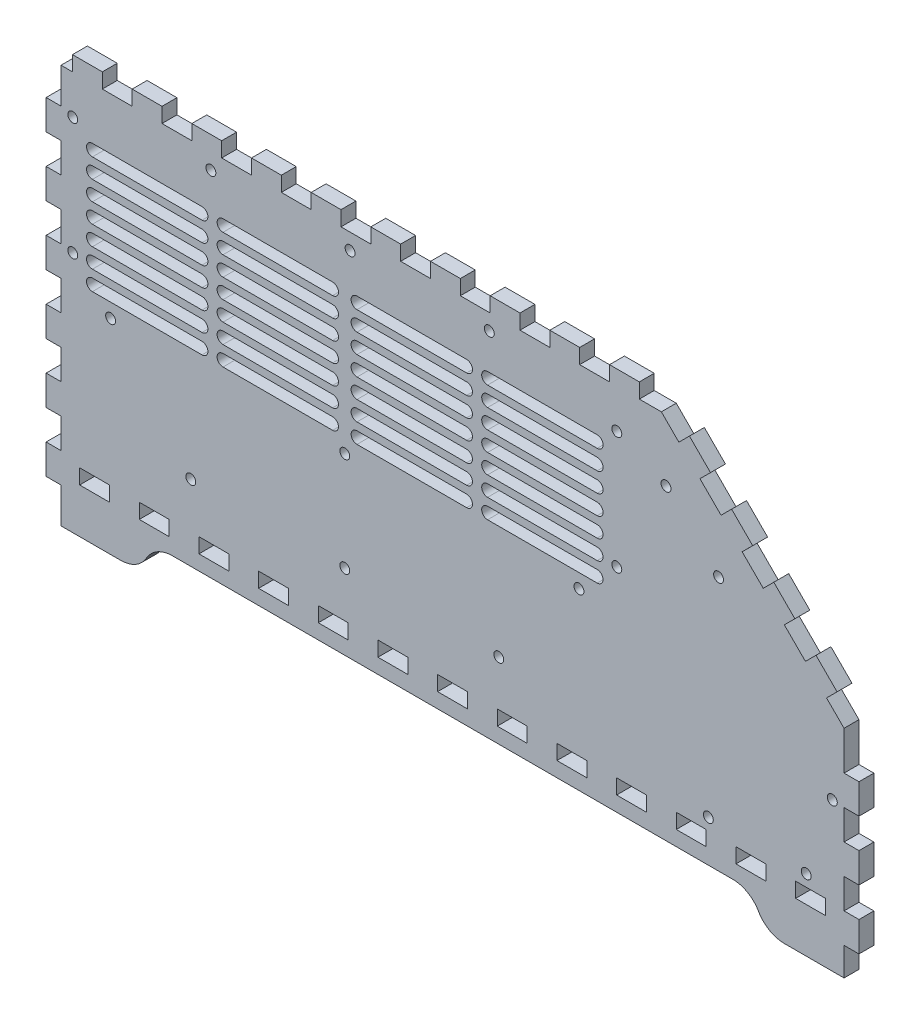
from build123d import *

# Parameters (mm, degrees)
BOSS_EXTRUDE1_DEPTH   = 5.715
CUT_EXTRUDE1_DEPTH    = 370.493090076
F_6_CLEARANCE_HOLE1_D = 3.7973


with BuildPart() as part:
    # Model → Boss-Extrude1 (new body)
    with BuildSketch(Plane.XY):
        Polygon((16.1148, 22.8575), (38.9749, 22.8575), (39.3485, 22.8575), (40.4689, 22.9567), (41.9322, 23.2475), (43.3447, 23.7271), (44.366, 24.2025), (44.6899, 24.3885), (44.8511, 24.4822), (45.3263, 24.7854), (45.9341, 25.2222), (46.5116, 25.6963), (47.056, 26.2062), (47.5657, 26.7505), (48.0399, 27.3279), (48.4766, 27.9356), (48.7796, 28.411), (48.8735, 28.5722), (48.9673, 28.7348), (49.2689, 29.2103), (49.7057, 29.818), (50.1798, 30.3954), (50.6899, 30.9397), (51.2339, 31.4496), (51.8114, 31.9236), (52.4192, 32.3605), (52.8948, 32.6622), (53.0571, 32.756), (53.3799, 32.9434), (54.4008, 33.4188), (55.8133, 33.8983), (57.2766, 34.1891), (58.3971, 34.287), (58.7721, 34.287), (273.458, 34.287), (273.831, 34.287), (274.952, 34.1891), (276.415, 33.8983), (277.828, 33.4188), (278.849, 32.9434), (279.172, 32.756), (279.334, 32.6636), (279.809, 32.3605), (280.417, 31.9236), (280.995, 31.4496), (281.539, 30.9397), (282.049, 30.3954), (282.523, 29.818), (282.96, 29.2103), (283.263, 28.7348), (283.356, 28.5722), (283.449, 28.411), (283.752, 27.9356), (284.189, 27.3279), (284.663, 26.7505), (285.172, 26.2062), (285.717, 25.6963), (286.294, 25.2222), (286.902, 24.7854), (287.377, 24.4822), (287.54, 24.3885), (287.862, 24.2025), (288.884, 23.7271), (290.296, 23.2475), (291.76, 22.9567), (292.88, 22.8575), (293.255, 22.8575), (316.115, 22.8575), (316.115, 33.6917), (321.83, 33.6917), (321.83, 45.1224), (316.115, 45.1224), (316.115, 56.552), (321.83, 56.552), (321.83, 67.9813), (316.115, 67.9813), (316.115, 79.412), (321.83, 79.412), (321.83, 90.8417), (316.115, 90.8417), (316.115, 101.677), (316.115, 105.718), (309.403, 112.43), (313.444, 116.47), (305.362, 124.553), (301.321, 120.512), (293.238, 128.595), (297.28, 132.635), (289.198, 140.717), (285.156, 136.677), (277.074, 144.759), (281.114, 148.801), (273.032, 156.881), (268.992, 152.841), (260.91, 160.923), (264.951, 164.963), (256.869, 173.046), (252.827, 169.005), (246.115, 175.718), (242.074, 175.718), (237.68, 175.718), (237.68, 181.433), (226.249, 181.433), (226.249, 175.718), (214.82, 175.718), (214.82, 181.433), (203.389, 181.433), (203.389, 175.718), (191.959, 175.718), (191.959, 181.433), (180.53, 181.433), (180.53, 175.718), (169.099, 175.718), (169.099, 181.433), (157.67, 181.433), (157.67, 175.718), (146.239, 175.718), (146.239, 181.433), (134.809, 181.433), (134.809, 175.718), (123.38, 175.718), (123.38, 181.433), (111.949, 181.433), (111.949, 175.718), (100.52, 175.718), (100.52, 181.433), (89.0887, 181.433), (89.0887, 175.718), (77.6594, 175.718), (77.6594, 181.433), (66.2298, 181.433), (66.2298, 175.718), (54.7991, 175.718), (54.7991, 181.433), (43.3698, 181.433), (43.3698, 175.718), (31.9388, 175.718), (31.9388, 181.433), (20.5093, 181.433), (20.5093, 175.718), (16.1148, 175.718), (16.1148, 162.153), (10.4001, 162.153), (10.4001, 150.723), (16.1148, 150.723), (16.1148, 139.292), (10.4001, 139.292), (10.4001, 127.863), (16.1148, 127.863), (16.1148, 116.433), (10.4001, 116.433), (10.4001, 105.003), (16.1148, 105.003), (16.1148, 93.5729), (10.4001, 93.5729), (10.4001, 82.1422), (16.1148, 82.1422), (16.1148, 70.7125), (10.4001, 70.7125), (10.4001, 59.2832), (16.1148, 59.2832), (16.1148, 47.8525), (10.4001, 47.8525), (10.4001, 36.4229), (16.1148, 36.4229), align=None)
        Polygon((28.9553, 40.0032), (23.2406, 40.0032), (23.2406, 45.7179), (34.67, 45.7179), (34.67, 40.0032), align=None, mode=Mode.SUBTRACT)
        Polygon((51.8156, 40.0032), (46.0996, 40.0032), (46.0996, 45.7179), (57.5303, 45.7179), (57.5303, 40.0032), align=None, mode=Mode.SUBTRACT)
        Polygon((74.6746, 40.0032), (68.9599, 40.0032), (68.9599, 45.7179), (80.3906, 45.7179), (80.3906, 40.0032), align=None, mode=Mode.SUBTRACT)
        Polygon((97.5349, 40.0032), (91.8199, 40.0032), (91.8199, 45.7179), (103.25, 45.7179), (103.25, 40.0032), align=None, mode=Mode.SUBTRACT)
        Polygon((120.395, 40.0032), (114.68, 40.0032), (114.68, 45.7179), (126.11, 45.7179), (126.11, 40.0032), align=None, mode=Mode.SUBTRACT)
        Polygon((143.255, 40.0032), (137.541, 40.0032), (137.541, 45.7179), (148.97, 45.7179), (148.97, 40.0032), align=None, mode=Mode.SUBTRACT)
        Polygon((166.116, 40.0032), (160.4, 40.0032), (160.4, 45.7179), (171.83, 45.7179), (171.83, 40.0032), align=None, mode=Mode.SUBTRACT)
        Polygon((188.975, 40.0032), (183.26, 40.0032), (183.26, 45.7179), (194.691, 45.7179), (194.691, 40.0032), align=None, mode=Mode.SUBTRACT)
        Polygon((211.835, 40.0032), (206.12, 40.0032), (206.12, 45.7179), (217.55, 45.7179), (217.55, 40.0032), align=None, mode=Mode.SUBTRACT)
        Polygon((234.695, 40.0032), (228.98, 40.0032), (228.98, 45.7179), (240.41, 45.7179), (240.41, 40.0032), align=None, mode=Mode.SUBTRACT)
        Polygon((257.555, 40.0032), (251.841, 40.0032), (251.841, 45.7179), (263.27, 45.7179), (263.27, 40.0032), align=None, mode=Mode.SUBTRACT)
        Polygon((280.416, 40.0032), (274.7, 40.0032), (274.7, 45.7179), (286.13, 45.7179), (286.13, 40.0032), align=None, mode=Mode.SUBTRACT)
        Polygon((303.275, 40.0032), (297.56, 40.0032), (297.56, 45.7179), (308.991, 45.7179), (308.991, 40.0032), align=None, mode=Mode.SUBTRACT)
    extrude(amount=BOSS_EXTRUDE1_DEPTH)

    # Sketch1 → Cut-Extrude1 (cut, through all)
    with BuildSketch(Plane(origin=(0, 0, 0), x_dir=(-1, 0, 0), z_dir=(0, 0, -1))):
        with BuildLine():
            Line((-221.535820417, 155.8109373), (-179.535820417, 155.8109373))
            ThreePointArc((-179.535820417, 155.8109373), (-177.285820417, 153.5609373), (-179.535820417, 151.3109373))
            Line((-179.535820417, 151.3109373), (-221.535820417, 151.3109373))
            ThreePointArc((-221.535820417, 151.3109373), (-223.785820417, 153.5609373), (-221.535820417, 155.8109373))
        make_face()
        with BuildLine():
            Line((-221.535820417, 143.8609373), (-179.535820417, 143.8609373))
            ThreePointArc((-179.535820417, 143.8609373), (-177.285820417, 146.1109373), (-179.535820417, 148.3609373))
            Line((-179.535820417, 148.3609373), (-221.535820417, 148.3609373))
            ThreePointArc((-221.535820417, 148.3609373), (-223.785820417, 146.1109373), (-221.535820417, 143.8609373))
        make_face()
        with BuildLine():
            Line((-221.535820417, 136.4109373), (-179.535820417, 136.4109373))
            ThreePointArc((-179.535820417, 136.4109373), (-177.285820417, 138.6609373), (-179.535820417, 140.9109373))
            Line((-179.535820417, 140.9109373), (-221.535820417, 140.9109373))
            ThreePointArc((-221.535820417, 140.9109373), (-223.785820417, 138.6609373), (-221.535820417, 136.4109373))
        make_face()
        with BuildLine():
            Line((-221.535820417, 128.9609373), (-179.535820417, 128.9609373))
            ThreePointArc((-179.535820417, 128.9609373), (-177.285820417, 131.2109373), (-179.535820417, 133.4609373))
            Line((-179.535820417, 133.4609373), (-221.535820417, 133.4609373))
            ThreePointArc((-221.535820417, 133.4609373), (-223.785820417, 131.2109373), (-221.535820417, 128.9609373))
        make_face()
        with BuildLine():
            Line((-221.535820417, 121.5109373), (-179.535820417, 121.5109373))
            ThreePointArc((-179.535820417, 121.5109373), (-177.285820417, 123.7609373), (-179.535820417, 126.0109373))
            Line((-179.535820417, 126.0109373), (-221.535820417, 126.0109373))
            ThreePointArc((-221.535820417, 126.0109373), (-223.785820417, 123.7609373), (-221.535820417, 121.5109373))
        make_face()
        with BuildLine():
            Line((-221.535820417, 114.0609373), (-179.535820417, 114.0609373))
            ThreePointArc((-179.535820417, 114.0609373), (-177.285820417, 116.3109373), (-179.535820417, 118.5609373))
            Line((-179.535820417, 118.5609373), (-221.535820417, 118.5609373))
            ThreePointArc((-221.535820417, 118.5609373), (-223.785820417, 116.3109373), (-221.535820417, 114.0609373))
        make_face()
        with BuildLine():
            Line((-221.535820417, 106.6109373), (-179.535820417, 106.6109373))
            ThreePointArc((-179.535820417, 106.6109373), (-177.285820417, 108.8609373), (-179.535820417, 111.1109373))
            Line((-179.535820417, 111.1109373), (-221.535820417, 111.1109373))
            ThreePointArc((-221.535820417, 111.1109373), (-223.785820417, 108.8609373), (-221.535820417, 106.6109373))
        make_face()
        with BuildLine():
            Line((-129.503720992, 111.1109373), (-171.503720992, 111.1109373))
            ThreePointArc((-171.503720992, 111.1109373), (-173.753720992, 108.8609373), (-171.503720992, 106.6109373))
            Line((-171.503720992, 106.6109373), (-129.503720992, 106.6109373))
            ThreePointArc((-129.503720992, 106.6109373), (-127.253720992, 108.8609373), (-129.503720992, 111.1109373))
        make_face()
        with BuildLine():
            Line((-129.503720992, 118.5609373), (-171.503720992, 118.5609373))
            ThreePointArc((-171.503720992, 118.5609373), (-173.753720992, 116.3109373), (-171.503720992, 114.0609373))
            Line((-171.503720992, 114.0609373), (-129.503720992, 114.0609373))
            ThreePointArc((-129.503720992, 114.0609373), (-127.253720992, 116.3109373), (-129.503720992, 118.5609373))
        make_face()
        with BuildLine():
            Line((-129.503720992, 126.0109373), (-171.503720992, 126.0109373))
            ThreePointArc((-171.503720992, 126.0109373), (-173.753720992, 123.7609373), (-171.503720992, 121.5109373))
            Line((-171.503720992, 121.5109373), (-129.503720992, 121.5109373))
            ThreePointArc((-129.503720992, 121.5109373), (-127.253720992, 123.7609373), (-129.503720992, 126.0109373))
        make_face()
        with BuildLine():
            Line((-129.503720992, 133.4609373), (-171.503720992, 133.4609373))
            ThreePointArc((-171.503720992, 133.4609373), (-173.753720992, 131.2109373), (-171.503720992, 128.9609373))
            Line((-171.503720992, 128.9609373), (-129.503720992, 128.9609373))
            ThreePointArc((-129.503720992, 128.9609373), (-127.253720992, 131.2109373), (-129.503720992, 133.4609373))
        make_face()
        with BuildLine():
            Line((-129.503720992, 140.9109373), (-171.503720992, 140.9109373))
            ThreePointArc((-171.503720992, 140.9109373), (-173.753720992, 138.6609373), (-171.503720992, 136.4109373))
            Line((-171.503720992, 136.4109373), (-129.503720992, 136.4109373))
            ThreePointArc((-129.503720992, 136.4109373), (-127.253720992, 138.6609373), (-129.503720992, 140.9109373))
        make_face()
        with BuildLine():
            Line((-129.503720992, 148.3609373), (-171.503720992, 148.3609373))
            ThreePointArc((-171.503720992, 148.3609373), (-173.753720992, 146.1109373), (-171.503720992, 143.8609373))
            Line((-171.503720992, 143.8609373), (-129.503720992, 143.8609373))
            ThreePointArc((-129.503720992, 143.8609373), (-127.253720992, 146.1109373), (-129.503720992, 148.3609373))
        make_face()
        with BuildLine():
            Line((-129.503720992, 155.8109373), (-171.503720992, 155.8109373))
            ThreePointArc((-171.503720992, 155.8109373), (-173.753720992, 153.5609373), (-171.503720992, 151.3109373))
            Line((-171.503720992, 151.3109373), (-129.503720992, 151.3109373))
            ThreePointArc((-129.503720992, 151.3109373), (-127.253720992, 153.5609373), (-129.503720992, 155.8109373))
        make_face()
        with BuildLine():
            Line((-28.134624406, 155.8109373), (-70.134624406, 155.8109373))
            ThreePointArc((-70.134624406, 155.8109373), (-72.384624406, 153.5609373), (-70.134624406, 151.3109373))
            Line((-70.134624406, 151.3109373), (-28.134624406, 151.3109373))
            ThreePointArc((-28.134624406, 151.3109373), (-25.884624406, 153.5609373), (-28.134624406, 155.8109373))
        make_face()
        with BuildLine():
            Line((-28.134624406, 148.3609373), (-70.134624406, 148.3609373))
            ThreePointArc((-70.134624406, 148.3609373), (-72.384624406, 146.1109373), (-70.134624406, 143.8609373))
            Line((-70.134624406, 143.8609373), (-28.134624406, 143.8609373))
            ThreePointArc((-28.134624406, 143.8609373), (-25.884624406, 146.1109373), (-28.134624406, 148.3609373))
        make_face()
        with BuildLine():
            Line((-28.134624406, 140.9109373), (-70.134624406, 140.9109373))
            ThreePointArc((-70.134624406, 140.9109373), (-72.384624406, 138.6609373), (-70.134624406, 136.4109373))
            Line((-70.134624406, 136.4109373), (-28.134624406, 136.4109373))
            ThreePointArc((-28.134624406, 136.4109373), (-25.884624406, 138.6609373), (-28.134624406, 140.9109373))
        make_face()
        with BuildLine():
            Line((-28.134624406, 133.4609373), (-70.134624406, 133.4609373))
            ThreePointArc((-70.134624406, 133.4609373), (-72.384624406, 131.2109373), (-70.134624406, 128.9609373))
            Line((-70.134624406, 128.9609373), (-28.134624406, 128.9609373))
            ThreePointArc((-28.134624406, 128.9609373), (-25.884624406, 131.2109373), (-28.134624406, 133.4609373))
        make_face()
        with BuildLine():
            Line((-28.134624406, 126.0109373), (-70.134624406, 126.0109373))
            ThreePointArc((-70.134624406, 126.0109373), (-72.384624406, 123.7609373), (-70.134624406, 121.5109373))
            Line((-70.134624406, 121.5109373), (-28.134624406, 121.5109373))
            ThreePointArc((-28.134624406, 121.5109373), (-25.884624406, 123.7609373), (-28.134624406, 126.0109373))
        make_face()
        with BuildLine():
            Line((-28.134624406, 118.5609373), (-70.134624406, 118.5609373))
            ThreePointArc((-70.134624406, 118.5609373), (-72.384624406, 116.3109373), (-70.134624406, 114.0609373))
            Line((-70.134624406, 114.0609373), (-28.134624406, 114.0609373))
            ThreePointArc((-28.134624406, 114.0609373), (-25.884624406, 116.3109373), (-28.134624406, 118.5609373))
        make_face()
        with BuildLine():
            Line((-28.134624406, 111.1109373), (-70.134624406, 111.1109373))
            ThreePointArc((-70.134624406, 111.1109373), (-72.384624406, 108.8609373), (-70.134624406, 106.6109373))
            Line((-70.134624406, 106.6109373), (-28.134624406, 106.6109373))
            ThreePointArc((-28.134624406, 106.6109373), (-25.884624406, 108.8609373), (-28.134624406, 111.1109373))
        make_face()
        with BuildLine():
            Line((-120.166723831, 111.1109373), (-78.166723831, 111.1109373))
            ThreePointArc((-78.166723831, 111.1109373), (-75.916723831, 108.8609373), (-78.166723831, 106.6109373))
            Line((-78.166723831, 106.6109373), (-120.166723831, 106.6109373))
            ThreePointArc((-120.166723831, 106.6109373), (-122.416723831, 108.8609373), (-120.166723831, 111.1109373))
        make_face()
        with BuildLine():
            Line((-120.166723831, 118.5609373), (-78.166723831, 118.5609373))
            ThreePointArc((-78.166723831, 118.5609373), (-75.916723831, 116.3109373), (-78.166723831, 114.0609373))
            Line((-78.166723831, 114.0609373), (-120.166723831, 114.0609373))
            ThreePointArc((-120.166723831, 114.0609373), (-122.416723831, 116.3109373), (-120.166723831, 118.5609373))
        make_face()
        with BuildLine():
            Line((-120.166723831, 126.0109373), (-78.166723831, 126.0109373))
            ThreePointArc((-78.166723831, 126.0109373), (-75.916723831, 123.7609373), (-78.166723831, 121.5109373))
            Line((-78.166723831, 121.5109373), (-120.166723831, 121.5109373))
            ThreePointArc((-120.166723831, 121.5109373), (-122.416723831, 123.7609373), (-120.166723831, 126.0109373))
        make_face()
        with BuildLine():
            Line((-120.166723831, 133.4609373), (-78.166723831, 133.4609373))
            ThreePointArc((-78.166723831, 133.4609373), (-75.916723831, 131.2109373), (-78.166723831, 128.9609373))
            Line((-78.166723831, 128.9609373), (-120.166723831, 128.9609373))
            ThreePointArc((-120.166723831, 128.9609373), (-122.416723831, 131.2109373), (-120.166723831, 133.4609373))
        make_face()
        with BuildLine():
            Line((-120.166723831, 140.9109373), (-78.166723831, 140.9109373))
            ThreePointArc((-78.166723831, 140.9109373), (-75.916723831, 138.6609373), (-78.166723831, 136.4109373))
            Line((-78.166723831, 136.4109373), (-120.166723831, 136.4109373))
            ThreePointArc((-120.166723831, 136.4109373), (-122.416723831, 138.6609373), (-120.166723831, 140.9109373))
        make_face()
        with BuildLine():
            Line((-120.166723831, 148.3609373), (-78.166723831, 148.3609373))
            ThreePointArc((-78.166723831, 148.3609373), (-75.916723831, 146.1109373), (-78.166723831, 143.8609373))
            Line((-78.166723831, 143.8609373), (-120.166723831, 143.8609373))
            ThreePointArc((-120.166723831, 143.8609373), (-122.416723831, 146.1109373), (-120.166723831, 148.3609373))
        make_face()
        with BuildLine():
            Line((-120.166723831, 155.8109373), (-78.166723831, 155.8109373))
            ThreePointArc((-78.166723831, 155.8109373), (-75.916723831, 153.5609373), (-78.166723831, 151.3109373))
            Line((-78.166723831, 151.3109373), (-120.166723831, 151.3109373))
            ThreePointArc((-120.166723831, 151.3109373), (-122.416723831, 153.5609373), (-120.166723831, 155.8109373))
        make_face()
    extrude(amount=-CUT_EXTRUDE1_DEPTH, mode=Mode.SUBTRACT)

    # #6 Clearance Hole1 (through all)
    with Locations(Plane(origin=(0, 0, 0), x_dir=(-1, 0, 0), z_dir=(0, 0, -1))):
        with Locations((-126.869, 169.5805), (-73.535666667, 169.5805), (-180.202333333, 169.5805), (-229.0515, 160.7182), (-229.0515, 115.7182), (-214.5515, 101.2182), (-183.83525, 63.2182), (-124.83525, 63.2182), (-124.83315, 101.2182), (-35.1148, 101.2182), (-20.6148, 115.7182), (-65.83525, 63.2182), (-20.6148, 160.7182), (-311.618, 79.7182), (-301.618, 50.2182), (-264.118, 50.2182), (-268.051887771, 131.860802012), (-247.899344507, 152.013345276)):
            Hole(F_6_CLEARANCE_HOLE1_D / 2)


solid = part.part
